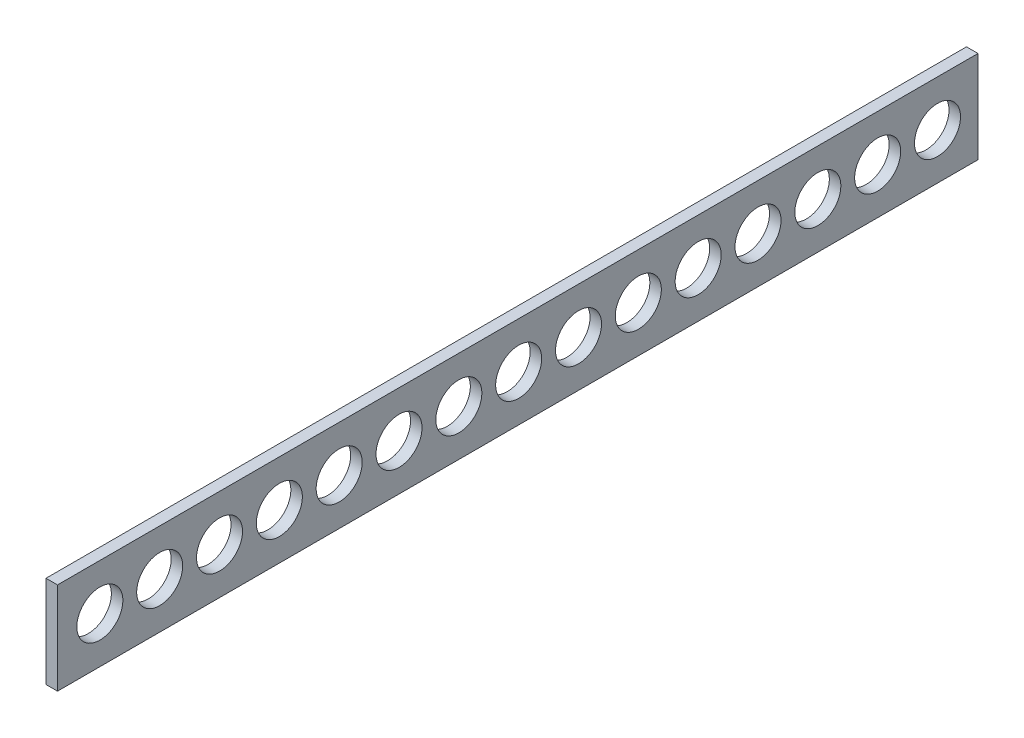
from build123d import *

# Parameters (mm, degrees)
SKETCH1_W           = 508
SKETCH1_H           = 50.8
SKETCH1_R           = 12.7
BOSS_EXTRUDE1_DEPTH = 6.35


with BuildPart() as part:
    # Sketch1 → Boss-Extrude1 (new body)
    with BuildSketch(Plane(origin=(0, 0, 0), x_dir=(0, 0, -1), z_dir=(1, 0, 0))):
        with Locations((254, 25.4)):
            Rectangle(SKETCH1_W, SKETCH1_H)
        with Locations((23.370832151, 25.4)):
            Circle(SKETCH1_R, mode=Mode.SUBTRACT)
        with Locations((56.390832151, 25.4)):
            Circle(SKETCH1_R, mode=Mode.SUBTRACT)
        with Locations((89.410832151, 25.4)):
            Circle(SKETCH1_R, mode=Mode.SUBTRACT)
        with Locations((122.430832151, 25.4)):
            Circle(SKETCH1_R, mode=Mode.SUBTRACT)
        with Locations((155.450832151, 25.4)):
            Circle(SKETCH1_R, mode=Mode.SUBTRACT)
        with Locations((188.470832151, 25.4)):
            Circle(SKETCH1_R, mode=Mode.SUBTRACT)
        with Locations((221.490832151, 25.4)):
            Circle(SKETCH1_R, mode=Mode.SUBTRACT)
        with Locations((254.510832151, 25.4)):
            Circle(SKETCH1_R, mode=Mode.SUBTRACT)
        with Locations((287.530832151, 25.4)):
            Circle(SKETCH1_R, mode=Mode.SUBTRACT)
        with Locations((320.550832151, 25.4)):
            Circle(SKETCH1_R, mode=Mode.SUBTRACT)
        with Locations((353.570832151, 25.4)):
            Circle(SKETCH1_R, mode=Mode.SUBTRACT)
        with Locations((386.590832151, 25.4)):
            Circle(SKETCH1_R, mode=Mode.SUBTRACT)
        with Locations((419.610832151, 25.4)):
            Circle(SKETCH1_R, mode=Mode.SUBTRACT)
        with Locations((452.630832151, 25.4)):
            Circle(SKETCH1_R, mode=Mode.SUBTRACT)
        with Locations((485.650832151, 25.4)):
            Circle(SKETCH1_R, mode=Mode.SUBTRACT)
    extrude(amount=BOSS_EXTRUDE1_DEPTH)


solid = part.part
